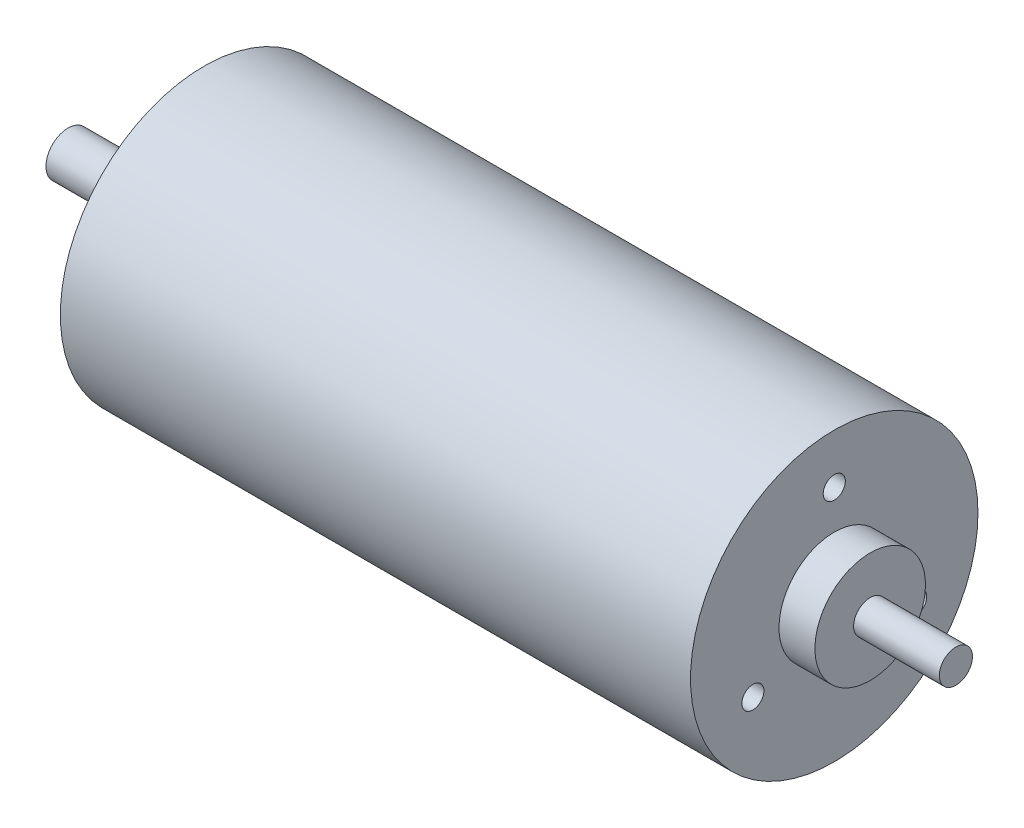
from build123d import *

# Parameters (mm, degrees)
SZKIC2_R                   = 1
WYTNIJ_WYCI_GNI_CIE1_DEPTH = 2.9


with BuildPart() as part:
    # Szkic1 → Obrót1 (revolve)
    with BuildSketch(Plane.XY):
        Polygon((0, 0), (0, 2), (11.2, 2), (11.2, 5), (12.3, 5), (12.3, 13), (69.3, 13), (69.3, 5), (72.55, 5), (72.55, 1.5), (80.3, 1.5), (80.3, 0), align=None)
    revolve(axis=Axis((0, 0, 0), (-1, 0, 0)))

    # Szkic2 → Wytnij-wyciągnięcie1 (cut)
    with BuildSketch(Plane(origin=(69.3, 0, 0), x_dir=(0, 0, -1), z_dir=(1, 0, 0))):
        with Locations((0, 8.5)):
            Circle(SZKIC2_R)
        with Locations((7.361215932, -4.25)):
            Circle(SZKIC2_R)
        with Locations((-7.361215932, -4.25)):
            Circle(SZKIC2_R)
    extrude(amount=-WYTNIJ_WYCI_GNI_CIE1_DEPTH, mode=Mode.SUBTRACT)


solid = part.part
